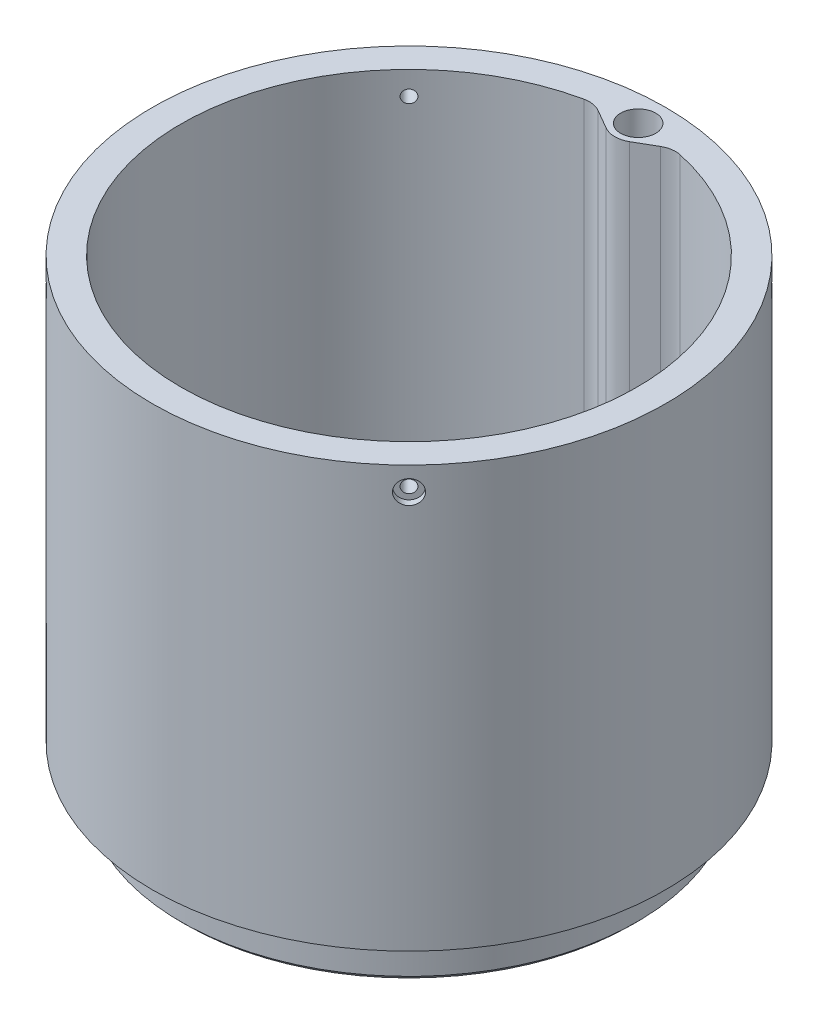
from build123d import *

# Parameters (mm, degrees)
SCHIZZO1_R                                           = 109.75
SCHIZZO1_R_2                                         = 7.5
ESTRUSIONE_ESTRUSIONE1_DEPTH                         = 180
FORO_LAMATO_PER_BULLONE_M5_A_TESTA_ESAGO_D           = 5.4
FORO_LAMATO_PER_BULLONE_M5_A_TESTA_ESAGO_DEPTH       = 20
FORO_LAMATO_PER_BULLONE_M5_A_TESTA_ESAGO_CBORE_D     = 10
FORO_LAMATO_PER_BULLONE_M5_A_TESTA_ESAGO_CBORE_DEPTH = 3
FORO_LAMATO_PER_BULLONE_M5_A_TESTA_ESAGO_TIP         = 1.622323671
FORO_LAMATO_PER_BULLONE_M5_A_TESTA_E_2_D             = 5.4
FORO_LAMATO_PER_BULLONE_M5_A_TESTA_E_2_DEPTH         = 20
FORO_LAMATO_PER_BULLONE_M5_A_TESTA_E_2_CBORE_D       = 10
FORO_LAMATO_PER_BULLONE_M5_A_TESTA_E_2_CBORE_DEPTH   = 3
FORO_LAMATO_PER_BULLONE_M5_A_TESTA_E_2_TIP           = 1.622323671
FORO_LAMATO_PER_BULLONE_M5_A_TESTA_E_3_D             = 5.4
FORO_LAMATO_PER_BULLONE_M5_A_TESTA_E_3_DEPTH         = 20
FORO_LAMATO_PER_BULLONE_M5_A_TESTA_E_3_CBORE_D       = 10
FORO_LAMATO_PER_BULLONE_M5_A_TESTA_E_3_CBORE_DEPTH   = 3
FORO_LAMATO_PER_BULLONE_M5_A_TESTA_E_3_TIP           = 1.622323671
FORO_LAMATO_PER_BULLONE_M5_A_TESTA_E_4_D             = 5.4
FORO_LAMATO_PER_BULLONE_M5_A_TESTA_E_4_DEPTH         = 20
FORO_LAMATO_PER_BULLONE_M5_A_TESTA_E_4_CBORE_D       = 10
FORO_LAMATO_PER_BULLONE_M5_A_TESTA_E_4_CBORE_DEPTH   = 3
FORO_LAMATO_PER_BULLONE_M5_A_TESTA_E_4_TIP           = 1.622323671
ESTRUSIONE_ESTRUSIONE2_DEPTH                         = 20
ESTRUSIONE_ESTRUSIONE3_DEPTH                         = 10
SMUSSO1_SIZE                                         = 10
RACCORDO1_R                                          = 10
SMUSSO2_SIZE                                         = 2


with BuildPart() as part:
    # Schizzo1 → Estrusione-Estrusione1 (new body)
    with BuildSketch(Plane(origin=(0, 0, 0), x_dir=(1, 0, 0), z_dir=(0, 1, 0))):
        with Locations(Location((0, 0, 0), (0, 0, 90))):
            Circle(SCHIZZO1_R)
        with Locations(Location((0, 98, 0), (0, 0, 90))):
            Circle(SCHIZZO1_R_2, mode=Mode.SUBTRACT)
        with BuildLine():
            Line((-16.652598983, 96.067377122), (-5, 89.339745962))
            ThreePointArc((-5, 89.339745962), (0, 88), (5, 89.339745962))
            Line((5, 89.339745962), (16.652598983, 96.067377122))
            ThreePointArc((16.652598983, 96.067377122), (0, -97.5), (-16.652598983, 96.067377122))
        make_face(mode=Mode.SUBTRACT)
    extrude(amount=ESTRUSIONE_ESTRUSIONE1_DEPTH)

    # Foro lamato per Bullone M5 a testa esagonale-1
    with Locations(Plane(origin=(-77.604969235, 170, -77.604969235), x_dir=(-0.707106781187, 0, 0.707106781187), z_dir=(-0.707106781187, 0, -0.707106781187))):
        with Locations((0, 0)):
            CounterBoreHole(FORO_LAMATO_PER_BULLONE_M5_A_TESTA_ESAGO_D / 2, FORO_LAMATO_PER_BULLONE_M5_A_TESTA_ESAGO_CBORE_D / 2, FORO_LAMATO_PER_BULLONE_M5_A_TESTA_ESAGO_CBORE_DEPTH, depth=FORO_LAMATO_PER_BULLONE_M5_A_TESTA_ESAGO_DEPTH)
            with Locations((0, 0, -(FORO_LAMATO_PER_BULLONE_M5_A_TESTA_ESAGO_DEPTH + FORO_LAMATO_PER_BULLONE_M5_A_TESTA_ESAGO_TIP / 2))):  # 118° drill point
                Cone(0, FORO_LAMATO_PER_BULLONE_M5_A_TESTA_ESAGO_D / 2, FORO_LAMATO_PER_BULLONE_M5_A_TESTA_ESAGO_TIP, mode=Mode.SUBTRACT)

    # Foro lamato per Bullone M5 a testa e 2
    with Locations(Plane(origin=(-77.604969235, 170, 77.604969235), x_dir=(0.707106781187, 0, 0.707106781187), z_dir=(-0.707106781187, 0, 0.707106781187))):
        with Locations((0, 0)):
            CounterBoreHole(FORO_LAMATO_PER_BULLONE_M5_A_TESTA_E_2_D / 2, FORO_LAMATO_PER_BULLONE_M5_A_TESTA_E_2_CBORE_D / 2, FORO_LAMATO_PER_BULLONE_M5_A_TESTA_E_2_CBORE_DEPTH, depth=FORO_LAMATO_PER_BULLONE_M5_A_TESTA_E_2_DEPTH)
            with Locations((0, 0, -(FORO_LAMATO_PER_BULLONE_M5_A_TESTA_E_2_DEPTH + FORO_LAMATO_PER_BULLONE_M5_A_TESTA_E_2_TIP / 2))):  # 118° drill point
                Cone(0, FORO_LAMATO_PER_BULLONE_M5_A_TESTA_E_2_D / 2, FORO_LAMATO_PER_BULLONE_M5_A_TESTA_E_2_TIP, mode=Mode.SUBTRACT)

    # Foro lamato per Bullone M5 a testa e 3
    with Locations(Plane(origin=(77.604969235, 170, -77.604969235), x_dir=(-0.707106781187, 0, -0.707106781187), z_dir=(0.707106781187, 0, -0.707106781187))):
        with Locations((0, 0)):
            CounterBoreHole(FORO_LAMATO_PER_BULLONE_M5_A_TESTA_E_3_D / 2, FORO_LAMATO_PER_BULLONE_M5_A_TESTA_E_3_CBORE_D / 2, FORO_LAMATO_PER_BULLONE_M5_A_TESTA_E_3_CBORE_DEPTH, depth=FORO_LAMATO_PER_BULLONE_M5_A_TESTA_E_3_DEPTH)
            with Locations((0, 0, -(FORO_LAMATO_PER_BULLONE_M5_A_TESTA_E_3_DEPTH + FORO_LAMATO_PER_BULLONE_M5_A_TESTA_E_3_TIP / 2))):  # 118° drill point
                Cone(0, FORO_LAMATO_PER_BULLONE_M5_A_TESTA_E_3_D / 2, FORO_LAMATO_PER_BULLONE_M5_A_TESTA_E_3_TIP, mode=Mode.SUBTRACT)

    # Foro lamato per Bullone M5 a testa e 4
    with Locations(Plane(origin=(77.604969235, 170, 77.604969235), x_dir=(0.707106781187, 0, -0.707106781187), z_dir=(0.707106781187, 0, 0.707106781187))):
        with Locations((0, 0)):
            CounterBoreHole(FORO_LAMATO_PER_BULLONE_M5_A_TESTA_E_4_D / 2, FORO_LAMATO_PER_BULLONE_M5_A_TESTA_E_4_CBORE_D / 2, FORO_LAMATO_PER_BULLONE_M5_A_TESTA_E_4_CBORE_DEPTH, depth=FORO_LAMATO_PER_BULLONE_M5_A_TESTA_E_4_DEPTH)
            with Locations((0, 0, -(FORO_LAMATO_PER_BULLONE_M5_A_TESTA_E_4_DEPTH + FORO_LAMATO_PER_BULLONE_M5_A_TESTA_E_4_TIP / 2))):  # 118° drill point
                Cone(0, FORO_LAMATO_PER_BULLONE_M5_A_TESTA_E_4_D / 2, FORO_LAMATO_PER_BULLONE_M5_A_TESTA_E_4_TIP, mode=Mode.SUBTRACT)



with BuildPart() as body_2:
    # Schizzo1<4> → Estrusione-Estrusione2 (new body)
    with BuildSketch(Plane(origin=(0, 0, 0), x_dir=(1, 0, 0), z_dir=(0, 1, 0))):
        with BuildLine():
            Line((-25, 85.937477273), (-21.68001113, 95.059071726))
            ThreePointArc((-21.68001113, 95.059071726), (0, -97.5), (21.68001113, 95.059071726))
            Line((21.68001113, 95.059071726), (25, 85.937477273))
            ThreePointArc((25, 85.937477273), (0, -89.5), (-25, 85.937477273))
        make_face()
    extrude(amount=-ESTRUSIONE_ESTRUSIONE2_DEPTH)


with BuildPart() as part_1:
    add(part.part)

    add(body_2.part)  # Estrusione-Estrusione3 merges body 2
    # Schizzo1<5> → Estrusione-Estrusione3 (add)
    with BuildSketch(Plane(origin=(0, 0, 0), x_dir=(1, 0, 0), z_dir=(0, 1, 0))):
        with BuildLine():
            Line((-25, 85.937477273), (-21.68001113, 95.059071726))
            ThreePointArc((-21.68001113, 95.059071726), (0, -97.5), (21.68001113, 95.059071726))
            Line((21.68001113, 95.059071726), (25, 85.937477273))
            ThreePointArc((25, 85.937477273), (0, -89.5), (-25, 85.937477273))
        make_face()
    extrude(amount=ESTRUSIONE_ESTRUSIONE3_DEPTH)

    # Smusso1
    # the kernel refuses this chamfer: 10 mm, written as the material it takes off along each edge
    with BuildSketch(Plane(origin=(0, 10, 0), x_dir=(0.0031415874858797023, 0, -0.9999950652018582), z_dir=(-0.9999950652018582, 0, -0.0031415874858797023))) as smusso1_piece_1_section:
        Polygon((89.5, SMUSSO1_SIZE), (89.5 + SMUSSO1_SIZE, 0), (89.5, 0), align=None)
    smusso1_piece_1 = revolve(axis=Axis((0, 10, 0), (0, -1, 0)), revolution_arc=359.64, mode=Mode.PRIVATE)
    smusso1_piece_1 = smusso1_piece_1 & Plane(origin=(0, 6.636633225, 0), x_dir=(0.17079588700932372, 0, -0.9853064320203632), z_dir=(0, -1, 0)) * Cylinder(97.5, 399, mode=Mode.PRIVATE)
    smusso1_piece_1 = split(smusso1_piece_1, bisect_by=Plane(origin=(35.757086514, 6.636633225, -107.09735814), z_dir=(0.5000000000000053, 0, 0.8660254037844358)), keep=Keep.TOP, mode=Mode.PRIVATE)
    add(smusso1_piece_1, mode=Mode.SUBTRACT)
    with BuildSketch(Plane(origin=(0, 10, 0), x_dir=(0.0031415874858797023, 0, -0.9999950652018582), z_dir=(-0.9999950652018582, 0, -0.0031415874858797023))) as smusso1_piece_2_section:
        Polygon((89.5, SMUSSO1_SIZE), (89.5 + SMUSSO1_SIZE, 0), (89.5, 0), align=None)
    smusso1_piece_2 = revolve(axis=Axis((0, 10, 0), (0, -1, 0)), revolution_arc=359.64, mode=Mode.PRIVATE)
    smusso1_piece_2 = smusso1_piece_2 & Plane(origin=(0, 6.636633226, 0), x_dir=(0.17079588700932372, 0, -0.9853064320203632), z_dir=(0, -1, 0)) * Cylinder(97.5, 399, mode=Mode.PRIVATE)
    smusso1_piece_2 = split(smusso1_piece_2, bisect_by=Plane(origin=(-34.569971333, 6.636633226, -59.64419713), z_dir=(-0.9396926207859074, 0, -0.3420201433256714)), keep=Keep.TOP, mode=Mode.PRIVATE)
    add(smusso1_piece_2, mode=Mode.SUBTRACT)

    # Raccordo1
    raccordo1_edges = [part_1.edges().sort_by_distance(p)[0] for p in [
        (-16.652598983, 90, -96.067377122),
        (16.652598983, 90, -96.067377122),
    ]]
    fillet(raccordo1_edges, radius=RACCORDO1_R)

    # Smusso2
    smusso2_edges = [part_1.edges().sort_by_distance(p)[0] for p in [
        (0, -20, 97.5),
        (0, -20, 89.5),
    ]]
    chamfer(smusso2_edges, length=SMUSSO2_SIZE)


solid = part_1.part
